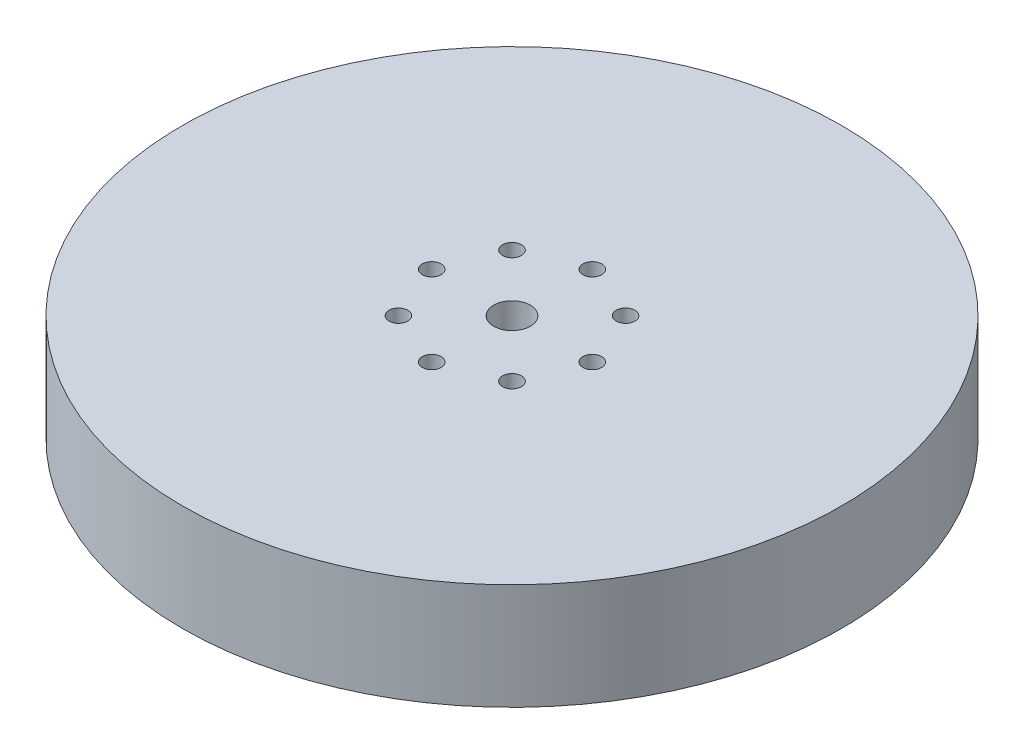
from build123d import *

# Parameters (mm, degrees)
SKETCH1_R           = 90
BOSS_EXTRUDE1_DEPTH = 29
SKETCH2_R           = 5
CUT_EXTRUDE1_DEPTH  = 131.541181242
SKETCH3_R           = 2.571104128
CUT_EXTRUDE2_DEPTH  = 17.925912871
CIRPATTERN1_COUNT   = 8


with BuildPart() as part:
    # Sketch1 → Boss-Extrude1 (new body)
    with BuildSketch(Plane(origin=(0, 0, 0), x_dir=(1, 0, 0), z_dir=(0, 1, 0))):
        Circle(SKETCH1_R)
    extrude(amount=BOSS_EXTRUDE1_DEPTH)

    # Sketch2 → Cut-Extrude1 (cut, through all)
    with BuildSketch(Plane(origin=(0, 0, 0), x_dir=(1, 0, 0), z_dir=(0, 1, 0))):
        Circle(SKETCH2_R)
    extrude(amount=CUT_EXTRUDE1_DEPTH, mode=Mode.SUBTRACT)

    # Sketch3 → Cut-Extrude2 (cut)
    with BuildSketch(Plane(origin=(0, 29, 0), x_dir=(1, 0, 0), z_dir=(0, 1, 0))):
        with Locations((-21.927290518, 0)):
            Circle(SKETCH3_R)
    cut_extrude2 = extrude(amount=-CUT_EXTRUDE2_DEPTH, mode=Mode.SUBTRACT)

    # CirPattern1: Cut-Extrude2 ×8 about axis
    cirpattern1_axis = Axis((0, 0, 0), (0, 1, 0))
    for i in range(1, CIRPATTERN1_COUNT):
        add(cut_extrude2.rotate(cirpattern1_axis, i * 360 / CIRPATTERN1_COUNT), mode=Mode.SUBTRACT)


solid = part.part
